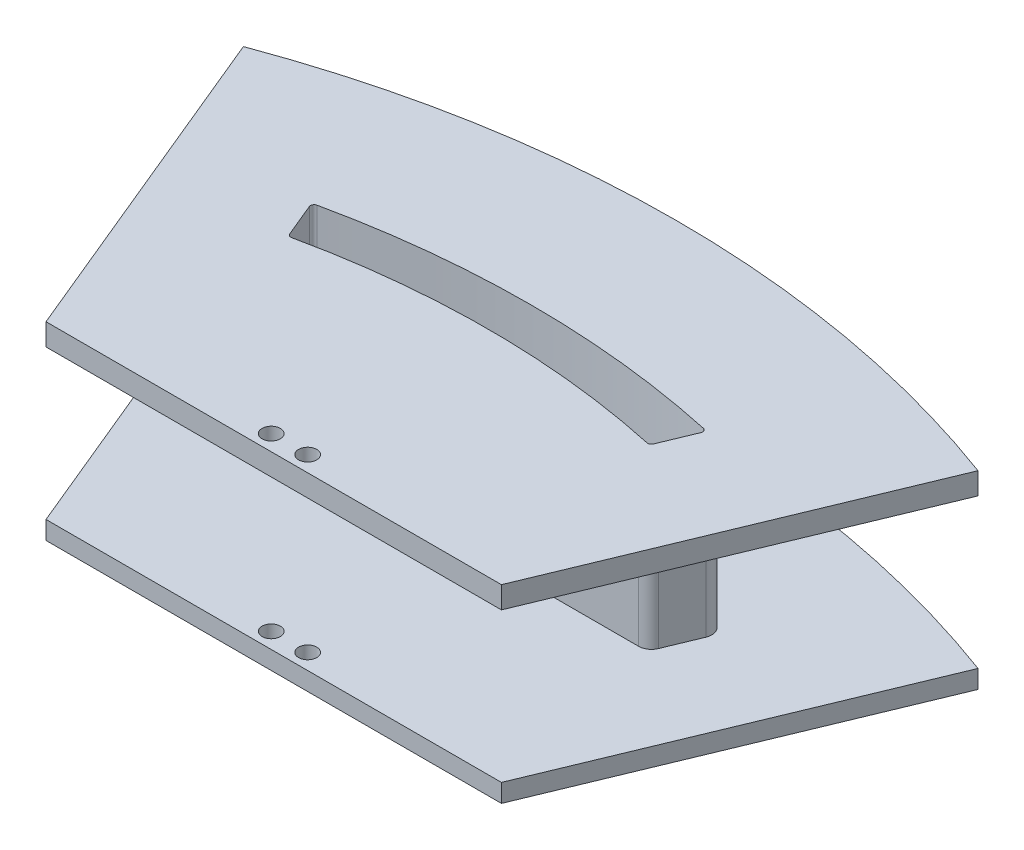
from build123d import *
from build123d.topology import SkipClean

# Parameters (mm, degrees)
SKETCH1_R           = 1.25
BOSS_EXTRUDE1_DEPTH = 2.5
BOSS_EXTRUDE2_START = 23.5
BOSS_EXTRUDE2_DEPTH = 26
BOSS_EXTRUDE3_START = 23.5
SKETCH1_4_R         = 1.25
BOSS_EXTRUDE3_DEPTH = 3


with BuildPart() as part:
    # Sketch1 → Boss-Extrude1 (new body)
    with BuildSketch(Plane(origin=(0, 0, 0), x_dir=(1, 0, 0), z_dir=(0, 1, 0))):
        with BuildLine():
            Line((-50.40491586, 135.957141986), (-31.25, 89.71308433))
            Line((-31.25, 89.71308433), (31.25, 89.71308433))
            Line((31.25, 89.71308433), (50.40491586, 135.957141986))
            ThreePointArc((50.40491586, 135.957141986), (0, 145), (-50.40491586, 135.957141986))
        make_face()
        with Locations(Location((-2.5, 91.868329805, 0), (0, 0, 270))):
            Circle(SKETCH1_R, mode=Mode.SUBTRACT)
        with Locations(Location((2.5, 91.868329805, 0), (0, 0, 270))):
            Circle(SKETCH1_R, mode=Mode.SUBTRACT)
        with BuildLine():
            Line((-26.870747539, 121.475518488), (-24.957330377, 116.856120826))
            ThreePointArc((-24.957330377, 116.856120826), (-24.727253788, 116.604473302), (-24.389349959, 116.558836529))
            ThreePointArc((-24.389349959, 116.558836529), (0, 119.174853647), (24.389349959, 116.558836529))
            ThreePointArc((24.389349959, 116.558836529), (24.727253788, 116.604473302), (24.957330377, 116.856120826))
            Line((24.957330377, 116.856120826), (26.870747539, 121.475518488))
            ThreePointArc((26.870747539, 121.475518488), (26.851801477, 121.898714852), (26.514867242, 122.155482133))
            ThreePointArc((26.514867242, 122.155482133), (0, 125), (-26.514867242, 122.155482133))
            ThreePointArc((-26.514867242, 122.155482133), (-26.851801477, 121.898714852), (-26.870747539, 121.475518488))
        make_face(mode=Mode.SUBTRACT)
    extrude(amount=-BOSS_EXTRUDE1_DEPTH)

    # Sketch1<3> → Boss-Extrude2 (add)
    with SkipClean():  # the faces are left unmerged after this step: merging them gives an invalid solid
        with BuildSketch(Plane(origin=(0, 0, 0), x_dir=(1, 0, 0), z_dir=(0, 1, 0)).offset(BOSS_EXTRUDE2_START)):
            with BuildLine():
                ThreePointArc((-26.780015914, 123.377036954), (-27.959285739, 122.478351471), (-28.025596955, 120.997164198))
                Line((-28.025596955, 120.997164198), (-26.112179793, 116.377766535))
                ThreePointArc((-26.112179793, 116.377766535), (-25.467638519, 115.59239072), (-24.495390611, 115.297462542))
                Line((-24.495390611, 115.297462542), (24.495390611, 115.297462542))
                ThreePointArc((24.495390611, 115.297462542), (25.467638519, 115.59239072), (26.112179793, 116.377766535))
                Line((26.112179793, 116.377766535), (28.025596955, 120.997164198))
                ThreePointArc((28.025596955, 120.997164198), (27.959285739, 122.478351471), (26.780015914, 123.377036954))
                ThreePointArc((26.780015914, 123.377036954), (0, 126.25), (-26.780015914, 123.377036954))
            make_face()
            with BuildLine():
                Line((-24.957330377, 116.856120826), (-26.870747539, 121.475518488))
                ThreePointArc((-26.870747539, 121.475518488), (-26.851801477, 121.898714852), (-26.514867242, 122.155482133))
                ThreePointArc((-26.514867242, 122.155482133), (0, 125), (26.514867242, 122.155482133))
                ThreePointArc((26.514867242, 122.155482133), (26.851801477, 121.898714852), (26.870747539, 121.475518488))
                Line((26.870747539, 121.475518488), (24.957330377, 116.856120826))
                ThreePointArc((24.957330377, 116.856120826), (24.727253788, 116.604473302), (24.389349959, 116.558836529))
                ThreePointArc((24.389349959, 116.558836529), (0, 119.174853647), (-24.389349959, 116.558836529))
                ThreePointArc((-24.389349959, 116.558836529), (-24.727253788, 116.604473302), (-24.957330377, 116.856120826))
            make_face(mode=Mode.SUBTRACT)
        extrude(amount=-BOSS_EXTRUDE2_DEPTH)
    add(part.part.scale(1), mode=Mode.REPLACE)  # the faces are merged on a copy

    # Sketch1<4> → Boss-Extrude3 (add)
    # profile 1 of 2: a face of its own
    with BuildSketch(Plane(origin=(0, 0, 0), x_dir=(1, 0, 0), z_dir=(0, 1, 0)).offset(BOSS_EXTRUDE3_START)):
        with BuildLine():
            ThreePointArc((-50.40491586, 135.957141986), (0, 145), (50.40491586, 135.957141986))
            Line((50.40491586, 135.957141986), (31.25, 89.71308433))
            Line((31.25, 89.71308433), (-31.25, 89.71308433))
            Line((-31.25, 89.71308433), (-50.40491586, 135.957141986))
        make_face()
        with Locations(Location((2.5, 91.868329805, 0), (0, 0, 270))):
            Circle(SKETCH1_4_R, mode=Mode.SUBTRACT)
        with Locations(Location((-2.5, 91.868329805, 0), (0, 0, 270))):
            Circle(SKETCH1_4_R, mode=Mode.SUBTRACT)
        with BuildLine():
            Line((-28.025596955, 120.997164198), (-26.112179793, 116.377766535))
            ThreePointArc((-26.112179793, 116.377766535), (-25.467638519, 115.59239072), (-24.495390611, 115.297462542))
            Line((-24.495390611, 115.297462542), (24.495390611, 115.297462542))
            ThreePointArc((24.495390611, 115.297462542), (25.467638519, 115.59239072), (26.112179793, 116.377766535))
            Line((26.112179793, 116.377766535), (28.025596955, 120.997164198))
            ThreePointArc((28.025596955, 120.997164198), (27.959285739, 122.478351471), (26.780015914, 123.377036954))
            ThreePointArc((26.780015914, 123.377036954), (0, 126.25), (-26.780015914, 123.377036954))
            ThreePointArc((-26.780015914, 123.377036954), (-27.959285739, 122.478351471), (-28.025596955, 120.997164198))
        make_face(mode=Mode.SUBTRACT)
    # profile 2 of 2: a face of its own
    with BuildSketch(Plane(origin=(0, 0, 0), x_dir=(1, 0, 0), z_dir=(0, 1, 0)).offset(BOSS_EXTRUDE3_START)):
        with BuildLine():
            ThreePointArc((-28.025596955, 120.997164198), (-27.959285739, 122.478351471), (-26.780015914, 123.377036954))
            ThreePointArc((-26.780015914, 123.377036954), (0, 126.25), (26.780015914, 123.377036954))
            ThreePointArc((26.780015914, 123.377036954), (27.959285739, 122.478351471), (28.025596955, 120.997164198))
            Line((28.025596955, 120.997164198), (26.112179793, 116.377766535))
            ThreePointArc((26.112179793, 116.377766535), (25.467638519, 115.59239072), (24.495390611, 115.297462542))
            Line((24.495390611, 115.297462542), (-24.495390611, 115.297462542))
            ThreePointArc((-24.495390611, 115.297462542), (-25.467638519, 115.59239072), (-26.112179793, 116.377766535))
            Line((-26.112179793, 116.377766535), (-28.025596955, 120.997164198))
        make_face()
        with BuildLine():
            Line((26.870747539, 121.475518488), (24.957330377, 116.856120826))
            ThreePointArc((24.957330377, 116.856120826), (24.727253788, 116.604473302), (24.389349959, 116.558836529))
            ThreePointArc((24.389349959, 116.558836529), (0, 119.174853647), (-24.389349959, 116.558836529))
            ThreePointArc((-24.389349959, 116.558836529), (-24.727253788, 116.604473302), (-24.957330377, 116.856120826))
            Line((-24.957330377, 116.856120826), (-26.870747539, 121.475518488))
            ThreePointArc((-26.870747539, 121.475518488), (-26.851801477, 121.898714852), (-26.514867242, 122.155482133))
            ThreePointArc((-26.514867242, 122.155482133), (0, 125), (26.514867242, 122.155482133))
            ThreePointArc((26.514867242, 122.155482133), (26.851801477, 121.898714852), (26.870747539, 121.475518488))
        make_face(mode=Mode.SUBTRACT)
    extrude(amount=-BOSS_EXTRUDE3_DEPTH)


solid = part.part
